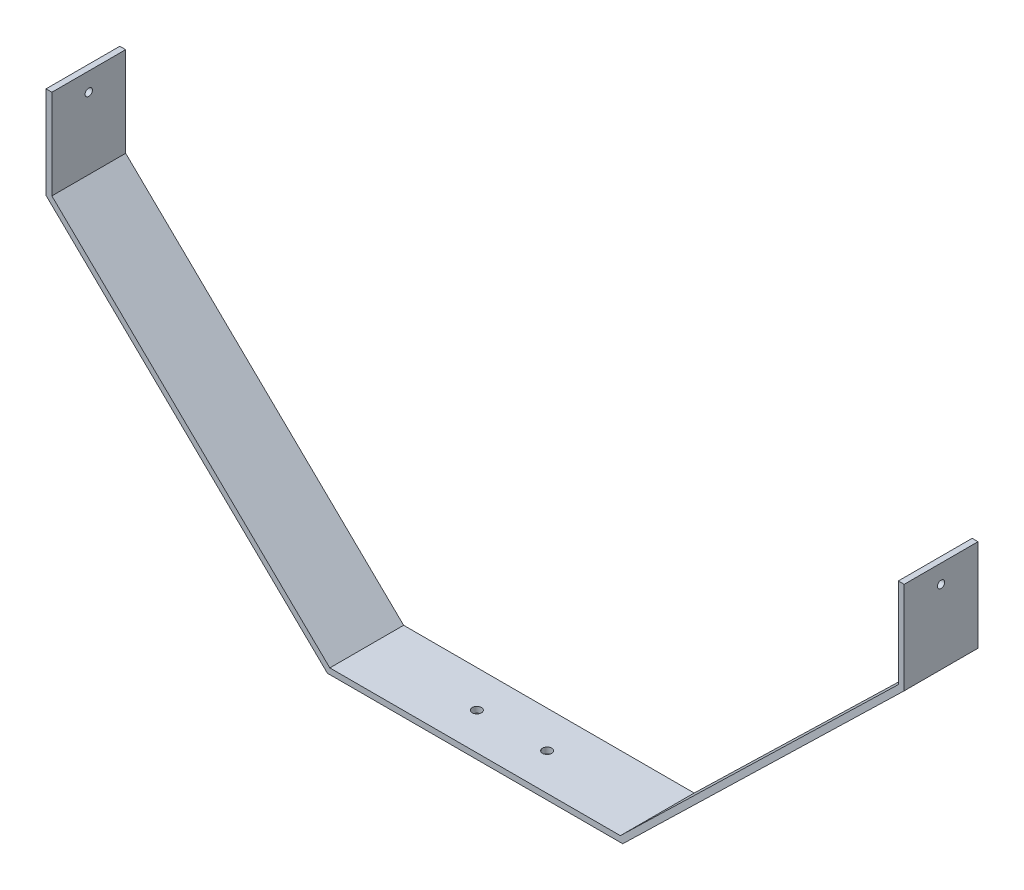
from build123d import *

# Parameters (mm, degrees)
BOSS_EXTRUDE1_DEPTH     = 40
CUT_EXTRUDE1_DEPTH      = 306.96246604
CUT_EXTRUDE1_DEPTH_BACK = 306.96246604
SKETCH3_R               = 2.5
CUT_EXTRUDE2_DEPTH      = 507.98027575
CUT_EXTRUDE2_DEPTH_BACK = 507.98027575
SKETCH4_R               = 1.984375


with BuildPart() as part:
    # Sketch1 → Boss-Extrude1 (new body)
    with BuildSketch(Plane.XY):
        Polygon((-80, 0), (80, 0), (232.5, 148), (232.5, 198), (229.325, 198), (229.325, 149.343064798), (78.712635935, 3.175), (-78.712635935, 3.175), (-229.325, 149.343064798), (-229.325, 198), (-232.5, 198), (-232.5, 148), align=None)
    extrude(amount=BOSS_EXTRUDE1_DEPTH)

    # Sketch3 → Cut-Extrude1 (cut, two sides: drawn at the far end of the back side and taken through both)
    with BuildSketch(Plane(origin=(0, 3.175, 0), x_dir=(1, 0, 0), z_dir=(0, 1, 0)).offset(-CUT_EXTRUDE1_DEPTH_BACK)):
        with Locations((-19.05, -20)):
            Circle(SKETCH3_R)
        with Locations((19.05, -20)):
            Circle(SKETCH3_R)
    extrude(amount=CUT_EXTRUDE1_DEPTH + CUT_EXTRUDE1_DEPTH_BACK, mode=Mode.SUBTRACT)

    # Sketch4 → Cut-Extrude2 (cut, two sides: drawn at the far end of the back side and taken through both)
    with BuildSketch(Plane.ZY.offset(232.5).offset(-CUT_EXTRUDE2_DEPTH_BACK)):
        with Locations((20, 188)):
            Circle(SKETCH4_R)
    extrude(amount=CUT_EXTRUDE2_DEPTH + CUT_EXTRUDE2_DEPTH_BACK, mode=Mode.SUBTRACT)


solid = part.part
